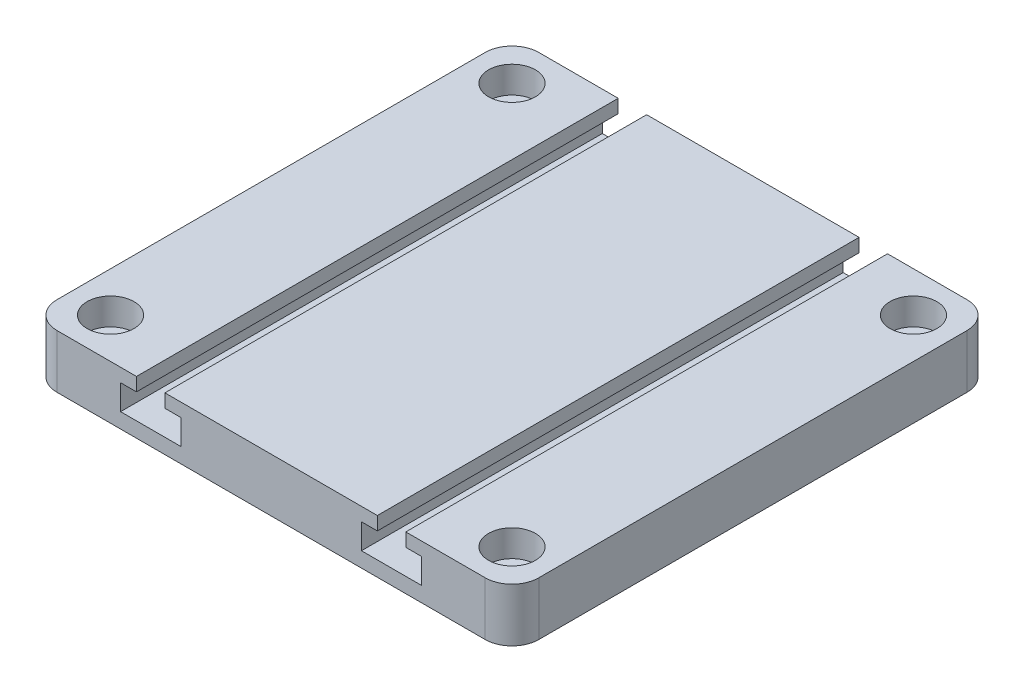
from build123d import *

# Parameters (mm, degrees)
SKETCH1_W                                        = 114.3
SKETCH1_H                                        = 114.3
BOSS_EXTRUDE1_DEPTH                              = 12.7
CBORE_FOR_1_4_SOCKET_HEAD_CAP_SCREW1_D           = 6.5278
CBORE_FOR_1_4_SOCKET_HEAD_CAP_SCREW1_CBORE_D     = 11.1125
CBORE_FOR_1_4_SOCKET_HEAD_CAP_SCREW1_CBORE_DEPTH = 6.35
T_SLOT_CUT_WITH_MCMASTER_8789A16_BIT_DEPTH       = 129.420802443
FILLET1_R                                        = 6.35


with BuildPart() as part:
    # Sketch1 → Boss-Extrude1 (new body)
    with BuildSketch(Plane(origin=(0, 0, 0), x_dir=(1, 0, 0), z_dir=(0, 1, 0))):
        Rectangle(SKETCH1_W, SKETCH1_H)
    extrude(amount=BOSS_EXTRUDE1_DEPTH)

    # CBORE for 1/4 Socket Head Cap Screw1 (through all)
    with Locations(Plane(origin=(0, 12.7, 0), x_dir=(1, 0, 0), z_dir=(0, 1, 0))):
        with Locations((-47.625, 47.625), (47.625, 47.625), (47.625, -47.625), (-47.625, -47.625)):
            CounterBoreHole(CBORE_FOR_1_4_SOCKET_HEAD_CAP_SCREW1_D / 2, CBORE_FOR_1_4_SOCKET_HEAD_CAP_SCREW1_CBORE_D / 2, CBORE_FOR_1_4_SOCKET_HEAD_CAP_SCREW1_CBORE_DEPTH)

    # Sketch4 → T-SLOT CUT WITH MCMASTER 8789A16 BIT (cut, through all)
    with BuildSketch(Plane.XY.offset(57.15)):
        Polygon((-31.9484375, 12.7), (-31.9484375, 9.525), (-35.71875, 9.525), (-35.71875, 3.571875), (-21.43125, 3.571875), (-21.43125, 9.525), (-25.2015625, 9.525), (-25.2015625, 12.7), align=None)
        Polygon((25.2015625, 9.525), (25.2015625, 12.7), (31.9484375, 12.7), (31.9484375, 9.525), (35.71875, 9.525), (35.71875, 3.571875), (21.43125, 3.571875), (21.43125, 9.525), align=None)
    extrude(amount=-T_SLOT_CUT_WITH_MCMASTER_8789A16_BIT_DEPTH, mode=Mode.SUBTRACT)

    # Fillet1
    fillet1_edges = [part.edges().sort_by_distance(p)[0] for p in [
        (-57.15, 6.35, 57.15),
        (57.15, 6.35, 57.15),
        (57.15, 6.35, -57.15),
        (-57.15, 6.35, -57.15),
    ]]
    fillet(fillet1_edges, radius=FILLET1_R)


solid = part.part
